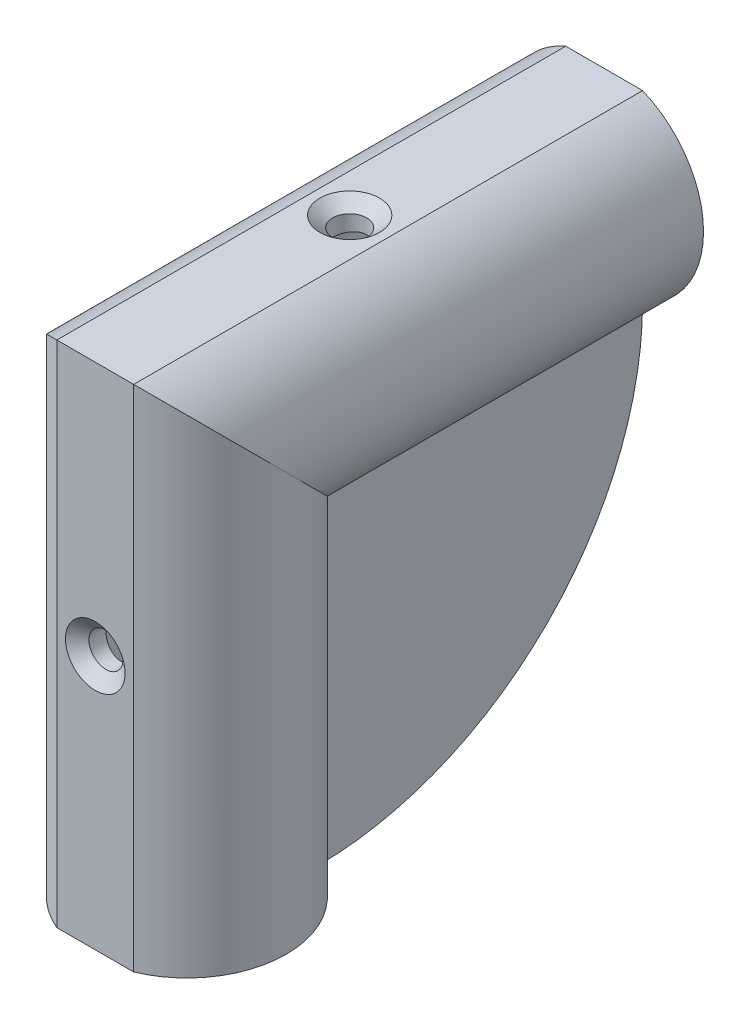
from build123d import *

# Parameters (mm, degrees)
SKETCH2_R                                       = 6.35
BOSS_EXTRUDE3_DEPTH                             = 3.175
BOSS_EXTRUDE4_DEPTH                             = 3.175
BOSS_EXTRUDE5_DEPTH                             = 1.019725
CSK_FOR_4_FLAT_HEAD_MACHINE_SCREW_4_D           = 3.2639
CSK_FOR_4_FLAT_HEAD_MACHINE_SCREW_4_DEPTH       = 3.175
CSK_FOR_4_FLAT_HEAD_MACHINE_SCREW_4_CSINK_D     = 5.715
CSK_FOR_4_FLAT_HEAD_MACHINE_SCREW_4_CSINK_ANGLE = 100


# Read off the part's stored shape, not the designer's step: CSK for #4 Flat Head Machine Screw (100)1
with BuildPart() as part:
    # Sweep1: sweep along a path in Sketch5
    with BuildLine(Plane(origin=(0, 0, 0), x_dir=(0, 0, -1), z_dir=(1, 0, 0))) as sweep1_path:
        Line((0, 0), (0, 40))
        Line((0, 40), (40, 40))
    # Sketch2 → Sweep1 (sweep)
    with BuildSketch(Plane(origin=(0, 0, 0), x_dir=(1, 0, 0), z_dir=(0, 1, 0))):
        with BuildLine():
            Line((-3.684990204, -8.783413773), (3.684734386, -8.783413773))
            ThreePointArc((3.684734386, -8.783413773), (9.525, 0), (3.684734386, 8.783413773))
            Line((3.684734386, 8.783413773), (-3.684990204, 8.783413773))
            ThreePointArc((-3.684990204, 8.783413773), (-9.525098966, 0), (-3.684990204, -8.783413773))
        make_face()
        Circle(SKETCH2_R, mode=Mode.SUBTRACT)
    sweep(path=sweep1_path.line, transition=Transition.RIGHT)

    # CSK for _4 Flat Head Machine Screw _ 2 → CSK for _4 Flat Head Machine Screw _100 (revolve, cut)
    with BuildSketch(Plane(origin=(-0.000127909, 0, -15.608293114), x_dir=(1, 0, 0), z_dir=(0, 0, 1))):
        Polygon((0, 46.136589997), (1.63195, 46.136589997), (1.63195, 47.75505522), (2.8575, 48.783413773), (0, 48.783413773), align=None)
    revolve(axis=Axis((-0.000127909, 0, -15.608293114), (0, 1, 0)), mode=Mode.SUBTRACT)

    # CSK for _4 Flat Head Machine Screw _ 3 o → CSK for _4 Flat Head Machine Screw _ 3 (revolve, cut)
    with BuildSketch(Plane(origin=(-6.3954e-05, 24.391706886, 0), x_dir=(1, 0, 0), z_dir=(0, -1, 0))):
        Polygon((0, 6.13660701), (1.63195, 6.13660701), (1.63195, 7.75505522), (2.8575, 8.783413773), (0, 8.783413773), align=None)
    revolve(axis=Axis((-6.3954e-05, 24.391706886, 0), (0, 0, 1)), mode=Mode.SUBTRACT)

    # Sketch13 → Boss-Extrude3 (add)
    with BuildSketch(Plane(origin=(-3.684990204, 0, 0), x_dir=(0, 0, -1), z_dir=(1, 0, 0))):
        with BuildLine():
            ThreePointArc((11.983413773, 0.164448528), (30.85687358, 9.14312642), (39.835551472, 28.016586227))
            Line((39.835551472, 28.016586227), (11.983413773, 28.016586227))
            Line((11.983413773, 28.016586227), (11.983413773, 0.164448528))
        make_face()
        with BuildLine():
            Line((40, 31.216586227), (8.783413773, 31.216586227))
            Line((8.783413773, 31.216586227), (8.783413773, 0))
            ThreePointArc((8.783413773, 0), (10.385525139, 0.04113924), (11.983413773, 0.164448528))
            Line((11.983413773, 0.164448528), (11.983413773, 28.016586227))
            Line((11.983413773, 28.016586227), (39.835551472, 28.016586227))
            ThreePointArc((39.835551472, 28.016586227), (39.95886076, 29.614474861), (40, 31.216586227))
        make_face()
    extrude(amount=BOSS_EXTRUDE3_DEPTH)

    # Sketch15 → Boss-Extrude4 (add)
    with BuildSketch(Plane(origin=(-0.509990204, 0, 0), x_dir=(0, 0, -1), z_dir=(1, 0, 0))):
        with BuildLine():
            Line((8.783413773, 31.216586227), (40, 31.216586227))
            ThreePointArc((40, 31.216586227), (39.95886076, 29.614474861), (39.835551472, 28.016586227))
            Line((39.835551472, 28.016586227), (11.983413773, 28.016586227))
            Line((11.983413773, 28.016586227), (11.983413773, 0.164448528))
            ThreePointArc((11.983413773, 0.164448528), (10.385525139, 0.04113924), (8.783413773, 0))
            Line((8.783413773, 0), (8.783413773, 31.216586227))
        make_face()
    extrude(amount=BOSS_EXTRUDE4_DEPTH)

    # Sketch16 → Boss-Extrude5 (add)
    with BuildSketch(Plane(origin=(2.665009796, 0, 0), x_dir=(0, 0, -1), z_dir=(1, 0, 0))):
        with BuildLine():
            Line((8.783413773, 31.216586227), (40, 31.216586227))
            ThreePointArc((40, 31.216586227), (30.85687358, 9.14312642), (8.783413773, 0))
            Line((8.783413773, 0), (8.783413773, 31.216586227))
        make_face()
    extrude(amount=BOSS_EXTRUDE5_DEPTH)

    # CSK for _4 Flat Head Machine Screw _ 4
    with Locations(Plane.ZY.offset(3.684990204)):
        with Locations((-27.511452395, 21.903897361), (-18.096102639, 12.488547605)):
            CounterSinkHole(CSK_FOR_4_FLAT_HEAD_MACHINE_SCREW_4_D / 2, CSK_FOR_4_FLAT_HEAD_MACHINE_SCREW_4_CSINK_D / 2, depth=CSK_FOR_4_FLAT_HEAD_MACHINE_SCREW_4_DEPTH, counter_sink_angle=CSK_FOR_4_FLAT_HEAD_MACHINE_SCREW_4_CSINK_ANGLE)


solid = part.part
